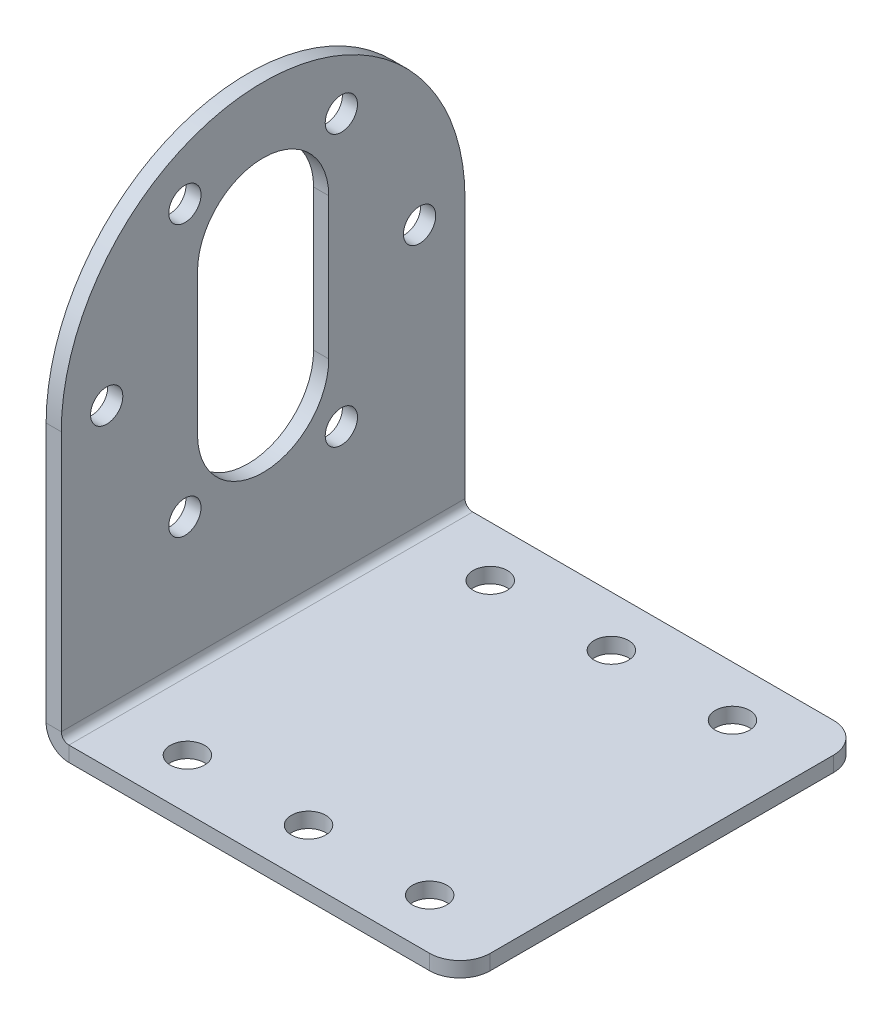
from build123d import *

# Parameters (mm, degrees)
BOSS_EXTRUDE1_DEPTH     = 1.5
SKETCH2_W               = 41
SKETCH2_H               = 40
BOSS_EXTRUDE2_DEPTH     = 1.5
CONVERT_SOLID1_START    = -20
CONVERT_SOLID1_DEPTH    = 40
CONVERT_SOLID1_2_DEPTH  = 40
M3_CLEARANCE_HOLE1_D    = 3.2
CIRPATTERN1_COUNT       = 6
CUT_EXTRUDE1_DEPTH      = 54.525694764
M3_CLEARANCE_HOLE2_D    = 3.4
LPATTERN1_COUNT         = 2
LPATTERN1_PITCH         = 24
LPATTERN1_COPY_1_D      = 3.4
FILLET1_R               = 3
CUT_EXTRUDE2_DEPTH      = 10
CUT_EXTRUDE2_DEPTH_BACK = 66.140233343
SKETCH12_R              = 1.7


# Read off the part's stored shape, not the designer's step: Convert-Solid1
with BuildPart() as part:
    # Sketch1 → Boss-Extrude1 (new body)
    with BuildSketch(Plane(origin=(0, 0, 0), x_dir=(0, 0, -1), z_dir=(1, 0, 0))):
        with BuildLine():
            Line((-20, 0), (-20, -28))
            Line((-20, -28), (20, -28))
            Line((20, -28), (20, 0))
            ThreePointArc((20, 0), (0, 20), (-20, 0))
        make_face()
    extrude(amount=BOSS_EXTRUDE1_DEPTH)

    # Sketch2 → Boss-Extrude2 (add)
    with BuildSketch(Plane.XZ.offset(28)):
        with Locations((20.5, 0)):
            Rectangle(SKETCH2_W, SKETCH2_H)
    extrude(amount=-BOSS_EXTRUDE2_DEPTH)

    # Convert-Solid1 outline → Convert-Solid1 (cut)
    with BuildSketch(Plane.XY.offset(CONVERT_SOLID1_START)):
        with BuildLine():
            Line((0, -28), (2.262, -28))
            ThreePointArc((2.262, -28), (0.662524461, -27.337475539), (0, -25.738))
            Line((0, -25.738), (0, -28))
        make_face()
    extrude(amount=CONVERT_SOLID1_DEPTH, mode=Mode.SUBTRACT)

    # Convert-Solid1 2 outline → Convert-Solid1 2 (add)
    with BuildSketch(Plane.XY.offset(CONVERT_SOLID1_START)):
        with BuildLine():
            Line((1.5, -26.5), (2.262, -26.5))
            ThreePointArc((2.262, -26.5), (1.723184633, -26.276815367), (1.5, -25.738))
            Line((1.5, -25.738), (1.5, -26.5))
        make_face()
    extrude(amount=CONVERT_SOLID1_2_DEPTH)

    # M3 Clearance Hole1 (through all)
    with Locations(Plane.ZY):
        with Locations((-15.5, 0)):
            m3_clearance_hole1 = Hole(M3_CLEARANCE_HOLE1_D / 2)

    # CirPattern1: M3 Clearance Hole1 ×6 about axis
    cirpattern1_axis = Axis((0, 0, 0), (1, 0, 0))
    for i in range(1, CIRPATTERN1_COUNT):
        add(m3_clearance_hole1.rotate(cirpattern1_axis, i * 360 / CIRPATTERN1_COUNT), mode=Mode.SUBTRACT)

    # Sketch9 → Cut-Extrude1 (cut, through all)
    with BuildSketch(Plane.ZY):
        with BuildLine():
            Line((6.5, 7), (6.5, -7))
            ThreePointArc((6.5, -7), (0, -13.5), (-6.5, -7))
            Line((-6.5, -7), (-6.5, 7))
            ThreePointArc((-6.5, 7), (0, 13.5), (6.5, 7))
        make_face()
    extrude(amount=-CUT_EXTRUDE1_DEPTH, mode=Mode.SUBTRACT)

    # M3 Clearance Hole2 (through all)
    with Locations(Plane(origin=(0, -26.5, 0), x_dir=(1, 0, 0), z_dir=(0, 1, 0))):
        with Locations((33, 15)):
            m3_clearance_hole2 = Hole(M3_CLEARANCE_HOLE2_D / 2)

    # Mirror1: M3 Clearance Hole2 across plane
    add(m3_clearance_hole2.mirror(Plane.XY), mode=Mode.SUBTRACT)

    # LPattern1: M3 Clearance Hole2 ×2
    with Locations(*[(-i * LPATTERN1_PITCH, 0, 0) for i in range(1, LPATTERN1_COUNT)]):
        add(m3_clearance_hole2, mode=Mode.SUBTRACT)

    # LPattern1 copy 1 (through all)
    with Locations(Plane(origin=(-24, -26.5, 0), x_dir=(1, 0, 0), z_dir=(0, 1, 0))):
        with Locations((33, -15)):
            Hole(LPATTERN1_COPY_1_D / 2)

    # Fillet1
    fillet1_edges = [part.edges().sort_by_distance(p)[0] for p in [
        (41, -27.25, 20),
        (41, -27.25, -20),
    ]]
    fillet(fillet1_edges, radius=FILLET1_R)

    # Sketch12 → Cut-Extrude2 (cut, two sides: drawn at the far end of the back side and taken through both)
    with BuildSketch(Plane(origin=(0, -26.5, 0), x_dir=(1, 0, 0), z_dir=(0, 1, 0)).offset(-CUT_EXTRUDE2_DEPTH_BACK)):
        with Locations(Location((21, 15, 0), (0, 0, 180))):
            Circle(SKETCH12_R)
        with Locations(Location((21, -15, 0), (0, 0, 180))):
            Circle(SKETCH12_R)
    extrude(amount=CUT_EXTRUDE2_DEPTH + CUT_EXTRUDE2_DEPTH_BACK, mode=Mode.SUBTRACT)


solid = part.part
